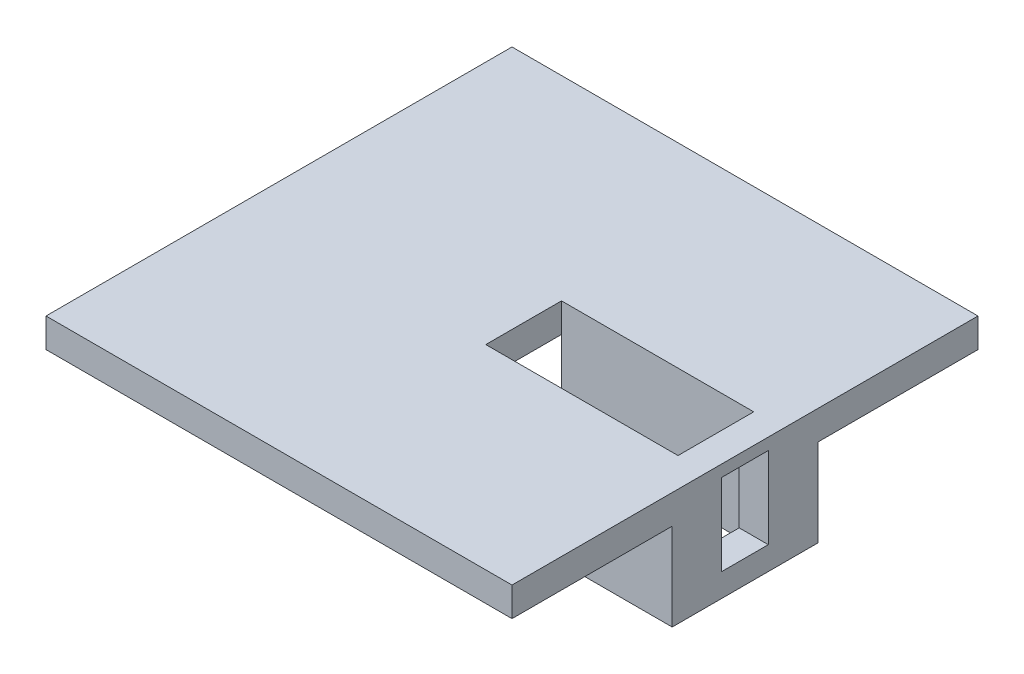
from build123d import *

# Parameters (mm, degrees)
SKETCH1_W           = 80
SKETCH1_H           = 80
BOSS_EXTRUDE1_DEPTH = 5
SKETCH2_W           = 33
SKETCH2_H           = 13
CUT_EXTRUDE1_DEPTH  = 114.247516529
BOSS_EXTRUDE2_DEPTH = 15
CUT_EXTRUDE2_REACH  = 116.127
SKETCH4_W           = 8
SKETCH4_H           = 14


with BuildPart() as part:
    # Sketch1 → Boss-Extrude1 (new body)
    with BuildSketch(Plane(origin=(0, 0, 0), x_dir=(1, 0, 0), z_dir=(0, 1, 0))):
        with Locations((40, 40)):
            Rectangle(SKETCH1_W, SKETCH1_H)
    extrude(amount=BOSS_EXTRUDE1_DEPTH)

    # Sketch2 → Cut-Extrude1 (cut, through all)
    with BuildSketch(Plane(origin=(0, 5, 0), x_dir=(1, 0, 0), z_dir=(0, 1, 0))):
        with Locations((58.5, 40)):
            Rectangle(SKETCH2_W, SKETCH2_H)
    extrude(amount=-CUT_EXTRUDE1_DEPTH, mode=Mode.SUBTRACT)

    # Sketch3 → Boss-Extrude2 (add)
    with BuildSketch(Plane.XZ):
        Polygon((42, -46.5), (42, -52.5), (80, -52.5), (80, -27.5), (42, -27.5), (42, -33.5), (75, -33.5), (75, -46.5), align=None)
    extrude(amount=BOSS_EXTRUDE2_DEPTH)

    # Sketch4 → Cut-Extrude2 (cut, up to next)
    with BuildSketch(Plane(origin=(80, 0, 0), x_dir=(0, 0, -1), z_dir=(1, 0, 0)), mode=Mode.PRIVATE) as cut_extrude2_sk1:
        with Locations((40, -4)):
            Rectangle(SKETCH4_W, SKETCH4_H)
    cut_extrude2_tool1 = extrude(cut_extrude2_sk1.sketch, amount=-CUT_EXTRUDE2_REACH, mode=Mode.PRIVATE) & part.part
    add(cut_extrude2_tool1.solids().sort_by_distance((80, -4, -40))[0], mode=Mode.SUBTRACT)


solid = part.part
